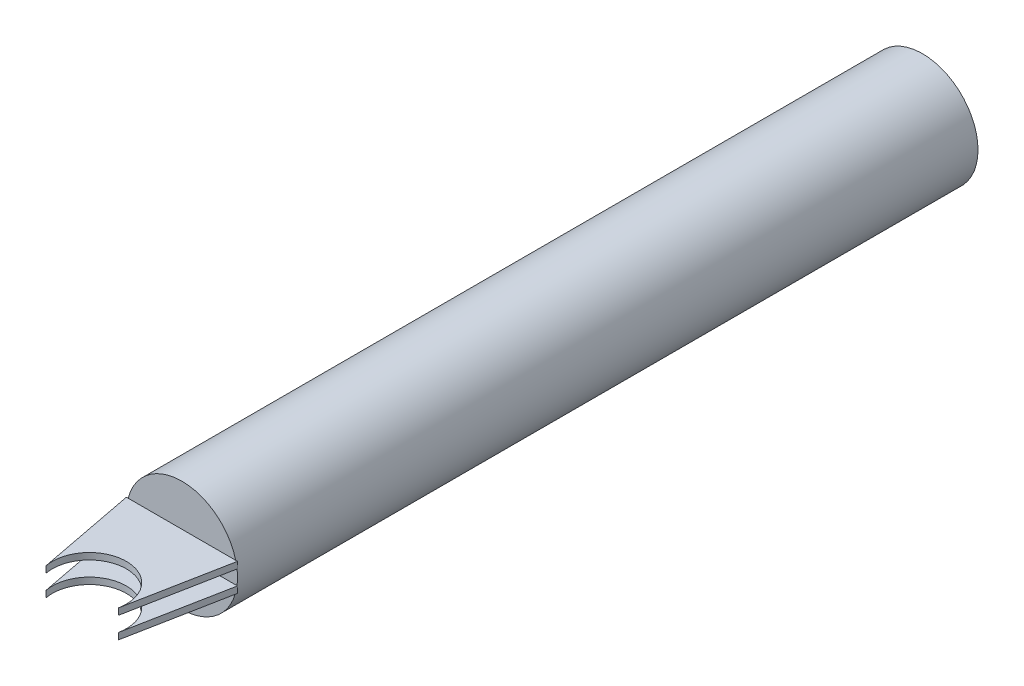
from build123d import *

# Parameters (mm, degrees)
POLE_SKETCH_R                   = 30
POLE_EXTRUDE_DEPTH              = 400
UPPER_START                     = 4
UPPER_PALM_HOLDER_EXTRUDE_DEPTH = 3.5
LOWER_START                     = -7.5
LOWER_PALM_HOLDER_EXTRUDE_DEPTH = 3.5


with BuildPart() as part:
    # Pole Sketch → Pole Extrude (new body)
    with BuildSketch(Plane.XY):
        Circle(POLE_SKETCH_R)
    extrude(amount=-POLE_EXTRUDE_DEPTH)

    # Palm Holder Sketch → Upper Palm Holder Extrude (add)
    with BuildSketch(Plane(origin=(0, 0, 0), x_dir=(1, 0, 0), z_dir=(0, 1, 0)).offset(UPPER_START)):
        with BuildLine():
            Line((19.63889875, -53.78333925), (30, 0))
            Line((30, 0), (-30, 0))
            Line((-30, 0), (-19.63889875, -53.78333925))
            ThreePointArc((-19.63889875, -53.78333925), (0, -30), (19.63889875, -53.78333925))
        make_face()
    extrude(amount=UPPER_PALM_HOLDER_EXTRUDE_DEPTH)

    # Palm Holder Sketch<2> → Lower Palm Holder Extrude (add)
    with BuildSketch(Plane(origin=(0, 0, 0), x_dir=(1, 0, 0), z_dir=(0, 1, 0)).offset(LOWER_START)):
        with BuildLine():
            Line((19.63889875, -53.78333925), (30, 0))
            Line((30, 0), (-30, 0))
            Line((-30, 0), (-19.63889875, -53.78333925))
            ThreePointArc((-19.63889875, -53.78333925), (0, -30), (19.63889875, -53.78333925))
        make_face()
    extrude(amount=LOWER_PALM_HOLDER_EXTRUDE_DEPTH)


solid = part.part
